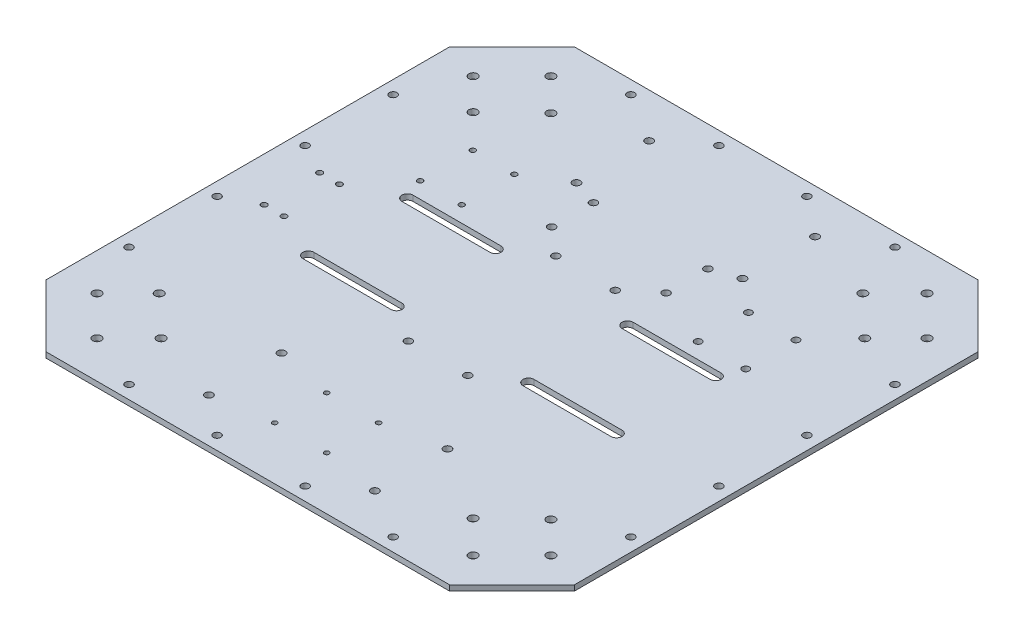
from build123d import *

# Parameters (mm, degrees)
BOSS_EXTRUDE1_DEPTH = 3.175
SKETCH2_R           = 2.4638
CUT_EXTRUDE1_DEPTH  = 6.35
SKETCH3_R           = 2.159
CUT_EXTRUDE2_DEPTH  = 6.35
SKETCH4_R           = 2.2225
CUT_EXTRUDE3_DEPTH  = 351.937720963
SKETCH5_R           = 1.651
CUT_EXTRUDE4_DEPTH  = 351.937720963
SKETCH6_R           = 2.032
SKETCH6_R_2         = 2.159
SKETCH6_R_3         = 1.397
SKETCH6_R_4         = 1.5499969
CUT_EXTRUDE5_DEPTH  = 351.937720963
SKETCH7_R           = 2.159
CUT_EXTRUDE6_DEPTH  = 351.937720963


with BuildPart() as part:
    # Sketch1 → Boss-Extrude1 (new body)
    with BuildSketch(Plane(origin=(0, 0, 0), x_dir=(1, 0, 0), z_dir=(0, 1, 0))):
        Polygon((-25.845025354, 51.656360067), (-61.766049839, 15.735335583), (-61.766049839, -217.222615449), (-25.845025354, -253.143639933), (207.112925677, -253.143639933), (243.033950161, -217.222615449), (243.033950161, 15.735335583), (207.112925677, 51.656360067), align=None)
        with BuildLine():
            ThreePointArc((52.533950161, -126.143639933), (55.708950161, -129.318639933), (52.533950161, -132.493639933))
            Line((52.533950161, -132.493639933), (1.733950161, -132.493639933))
            ThreePointArc((1.733950161, -132.493639933), (-1.441049839, -129.318639933), (1.733950161, -126.143639933))
            Line((1.733950161, -126.143639933), (52.533950161, -126.143639933))
        make_face(mode=Mode.SUBTRACT)
        with BuildLine():
            Line((179.533950161, -132.493639933), (128.733950161, -132.493639933))
            ThreePointArc((128.733950161, -132.493639933), (125.558950161, -129.318639933), (128.733950161, -126.143639933))
            Line((128.733950161, -126.143639933), (179.533950161, -126.143639933))
            ThreePointArc((179.533950161, -126.143639933), (182.708950161, -129.318639933), (179.533950161, -132.493639933))
        make_face(mode=Mode.SUBTRACT)
        with BuildLine():
            Line((1.733950161, -68.993639933), (52.533950161, -68.993639933))
            ThreePointArc((52.533950161, -68.993639933), (55.708950161, -72.168639933), (52.533950161, -75.343639933))
            Line((52.533950161, -75.343639933), (1.733950161, -75.343639933))
            ThreePointArc((1.733950161, -75.343639933), (-1.441049839, -72.168639933), (1.733950161, -68.993639933))
        make_face(mode=Mode.SUBTRACT)
        with BuildLine():
            ThreePointArc((128.733950161, -75.343639933), (125.558950161, -72.168639933), (128.733950161, -68.993639933))
            Line((128.733950161, -68.993639933), (179.533950161, -68.993639933))
            ThreePointArc((179.533950161, -68.993639933), (182.708950161, -72.168639933), (179.533950161, -75.343639933))
            Line((179.533950161, -75.343639933), (128.733950161, -75.343639933))
        make_face(mode=Mode.SUBTRACT)
    extrude(amount=BOSS_EXTRUDE1_DEPTH)

    # Sketch2 → Cut-Extrude1 (cut)
    with BuildSketch(Plane(origin=(0, 3.175, 0), x_dir=(1, 0, 0), z_dir=(0, 1, 0))):
        with Locations((-17.872380726, 30.213331256)):
            Circle(SKETCH2_R)
        with Locations((0.640891541, 11.70005899)):
            Circle(SKETCH2_R)
        with Locations((-22.362508786, -10.197821288)):
            Circle(SKETCH2_R)
        with Locations((-40.323021028, 7.762690954)):
            Circle(SKETCH2_R)
        with Locations((203.630409109, -10.197821288)):
            Circle(SKETCH2_R)
        with Locations((221.590921351, 7.762690954)):
            Circle(SKETCH2_R)
        with Locations((180.627008782, 11.70005899)):
            Circle(SKETCH2_R)
        with Locations((199.140281048, 30.213331256)):
            Circle(SKETCH2_R)
        with Locations((-22.362508786, -191.289458578)):
            Circle(SKETCH2_R)
        with Locations((-40.323021028, -209.24997082)):
            Circle(SKETCH2_R)
        with Locations((-17.872380726, -231.700611123)):
            Circle(SKETCH2_R)
        with Locations((0.640891541, -213.187338857)):
            Circle(SKETCH2_R)
        with Locations((221.590921351, -209.24997082)):
            Circle(SKETCH2_R)
        with Locations((199.140281048, -231.700611123)):
            Circle(SKETCH2_R)
        with Locations((180.627008782, -213.187338857)):
            Circle(SKETCH2_R)
        with Locations((203.630409109, -191.289458578)):
            Circle(SKETCH2_R)
    extrude(amount=-CUT_EXTRUDE1_DEPTH, mode=Mode.SUBTRACT)

    # Sketch3 → Cut-Extrude2 (cut)
    with BuildSketch(Plane(origin=(0, 3.175, 0), x_dir=(1, 0, 0), z_dir=(0, 1, 0))):
        with Locations((73.361950161, -58.198639933)):
            Circle(SKETCH3_R)
        with Locations((107.651950161, -58.198639933)):
            Circle(SKETCH3_R)
        with Locations((73.361950161, -143.288639933)):
            Circle(SKETCH3_R)
        with Locations((107.651950161, -143.288639933)):
            Circle(SKETCH3_R)
    extrude(amount=-CUT_EXTRUDE2_DEPTH, mode=Mode.SUBTRACT)

    # Sketch4 → Cut-Extrude3 (cut, through all)
    with BuildSketch(Plane(origin=(0, 3.175, 0), x_dir=(1, 0, 0), z_dir=(0, 1, 0))):
        with Locations((42.754950161, 26.256360067)):
            Circle(SKETCH4_R)
        with Locations((138.512950161, 26.256360067)):
            Circle(SKETCH4_R)
        with Locations((42.754950161, -15.653639933)):
            Circle(SKETCH4_R)
        with Locations((138.512950161, -15.653639933)):
            Circle(SKETCH4_R)
        with Locations((138.512950161, -185.833639933)):
            Circle(SKETCH4_R)
        with Locations((42.754950161, -185.833639933)):
            Circle(SKETCH4_R)
        with Locations((138.512950161, -227.743639933)):
            Circle(SKETCH4_R)
        with Locations((42.754950161, -227.743639933)):
            Circle(SKETCH4_R)
    extrude(amount=-CUT_EXTRUDE3_DEPTH, mode=Mode.SUBTRACT)

    # Sketch5 → Cut-Extrude4 (cut, through all)
    with BuildSketch(Plane(origin=(0, 3.175, 0), x_dir=(1, 0, 0), z_dir=(0, 1, 0))):
        with Locations((-36.366049839, -84.741639933)):
            Circle(SKETCH5_R)
        with Locations((-24.936049839, -84.741639933)):
            Circle(SKETCH5_R)
        with Locations((-24.936049839, -116.745639933)):
            Circle(SKETCH5_R)
        with Locations((-36.366049839, -116.745639933)):
            Circle(SKETCH5_R)
    extrude(amount=-CUT_EXTRUDE4_DEPTH, mode=Mode.SUBTRACT)

    # Sketch6 → Cut-Extrude5 (cut, through all)
    with BuildSketch(Plane(origin=(0, 3.175, 0), x_dir=(1, 0, 0), z_dir=(0, 1, 0))):
        with Locations((157.181950161, -30.893639933)):
            Circle(SKETCH6_R)
        with Locations((157.181950161, -59.849639933)):
            Circle(SKETCH6_R)
        with Locations((184.613950161, -59.849639933)):
            Circle(SKETCH6_R)
        with Locations((184.613950161, -30.893639933)):
            Circle(SKETCH6_R)
        with Locations((57.613950161, -20.733639933)):
            Circle(SKETCH6_R_2)
        with Locations((57.613950161, -44.863639933)):
            Circle(SKETCH6_R_2)
        with Locations((123.653950161, -44.863639933)):
            Circle(SKETCH6_R_2)
        with Locations((123.653950161, -20.733639933)):
            Circle(SKETCH6_R_2)
        with Locations((75.647950161, -192.691639933)):
            Circle(SKETCH6_R_3)
        with Locations((75.647950161, -222.663639933)):
            Circle(SKETCH6_R_3)
        with Locations((105.619950161, -222.663639933)):
            Circle(SKETCH6_R_3)
        with Locations((105.619950161, -192.691639933)):
            Circle(SKETCH6_R_3)
        with Locations((-3.388950787, -29.369639933)):
            Circle(SKETCH6_R_4)
        with Locations((-3.346049839, -59.769599662)):
            Circle(SKETCH6_R_4)
        with Locations((20.611052013, -29.369639933)):
            Circle(SKETCH6_R_4)
        with Locations((20.611052013, -59.769599662)):
            Circle(SKETCH6_R_4)
    extrude(amount=-CUT_EXTRUDE5_DEPTH, mode=Mode.SUBTRACT)

    # Sketch7 → Cut-Extrude6 (cut, through all)
    with BuildSketch(Plane(origin=(0, 3.175, 0), x_dir=(1, 0, 0), z_dir=(0, 1, 0))):
        with Locations((65.233950161, 44.036360067)):
            Circle(SKETCH7_R)
        with Locations((14.433950161, 44.036360067)):
            Circle(SKETCH7_R)
        with Locations((-54.146049839, -75.343639933)):
            Circle(SKETCH7_R)
        with Locations((-54.146049839, -24.543639933)):
            Circle(SKETCH7_R)
        with Locations((235.413950161, -24.543639933)):
            Circle(SKETCH7_R)
        with Locations((235.413950161, -75.343639933)):
            Circle(SKETCH7_R)
        with Locations((166.833950161, 44.036360067)):
            Circle(SKETCH7_R)
        with Locations((116.033950161, 44.036360067)):
            Circle(SKETCH7_R)
        with Locations((116.033950161, -245.523639933)):
            Circle(SKETCH7_R)
        with Locations((166.833950161, -245.523639933)):
            Circle(SKETCH7_R)
        with Locations((235.413950161, -126.143639933)):
            Circle(SKETCH7_R)
        with Locations((235.413950161, -176.943639933)):
            Circle(SKETCH7_R)
        with Locations((-54.146049839, -176.943639933)):
            Circle(SKETCH7_R)
        with Locations((-54.146049839, -126.143639933)):
            Circle(SKETCH7_R)
        with Locations((14.433950161, -245.523639933)):
            Circle(SKETCH7_R)
        with Locations((65.233950161, -245.523639933)):
            Circle(SKETCH7_R)
    extrude(amount=-CUT_EXTRUDE6_DEPTH, mode=Mode.SUBTRACT)


solid = part.part
